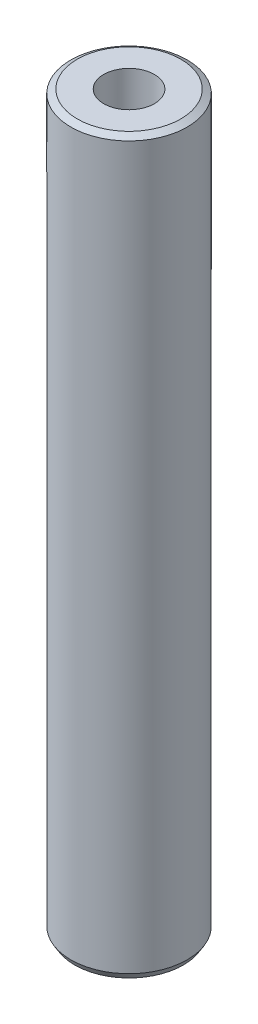
from build123d import *
from OCP.BRepFilletAPI import BRepFilletAPI_MakeChamfer

# Parameters (mm, degrees)
SKETCH1_R           = 22.5
BOSS_EXTRUDE1_DEPTH = 282.750199307
SKETCH2_R           = 9.802146828
CUT_EXTRUDE1_DEPTH  = 285.535015786
CHAMFER1_SIZE       = 1.475322972
CHAMFER1_SIZE2      = 2.48496516


with BuildPart() as part:
    # Sketch1 → Boss-Extrude1 (new body)
    with BuildSketch(Plane(origin=(0, 0, 0), x_dir=(1, 0, 0), z_dir=(0, 1, 0))):
        Circle(SKETCH1_R)
    extrude(amount=BOSS_EXTRUDE1_DEPTH)

    # Sketch2 → Cut-Extrude1 (cut, through all)
    with BuildSketch(Plane(origin=(0, 0, 0), x_dir=(1, 0, 0), z_dir=(0, 1, 0))):
        Circle(SKETCH2_R)
    extrude(amount=CUT_EXTRUDE1_DEPTH, mode=Mode.SUBTRACT)

    # Chamfer1: one chamfer whose edges measure the first distance from different faces: ONE call of the kernel's chamfer builder (chamfer() names one face for all edges)
    chamfer1_edges_1 = [part.edges().sort_by_distance(p)[0] for p in [
        (-22.5, 282.750199307, 0),
    ]]
    chamfer1_side_1 = [part.faces().sort_by_distance(p)[0] for p in [
        (-22.5, 141.375099654, 0),
    ]]
    chamfer1_edges_2 = [part.edges().sort_by_distance(p)[0] for p in [
        (-22.5, 0, 0),
    ]]
    chamfer1_side_2 = [part.faces().sort_by_distance(p)[0] for p in [
        (-21.863603897, 0, 0),
    ]]
    chamfer1 = BRepFilletAPI_MakeChamfer(part.part.solid().wrapped)
    for e in chamfer1_edges_1:
        chamfer1.Add(CHAMFER1_SIZE, CHAMFER1_SIZE2, e.wrapped, chamfer1_side_1[0].wrapped)  # the first distance lies on this face
    for e in chamfer1_edges_2:
        chamfer1.Add(CHAMFER1_SIZE, CHAMFER1_SIZE2, e.wrapped, chamfer1_side_2[0].wrapped)  # the first distance lies on this face
    add(Compound.cast(chamfer1.Shape()), mode=Mode.REPLACE)


solid = part.part
